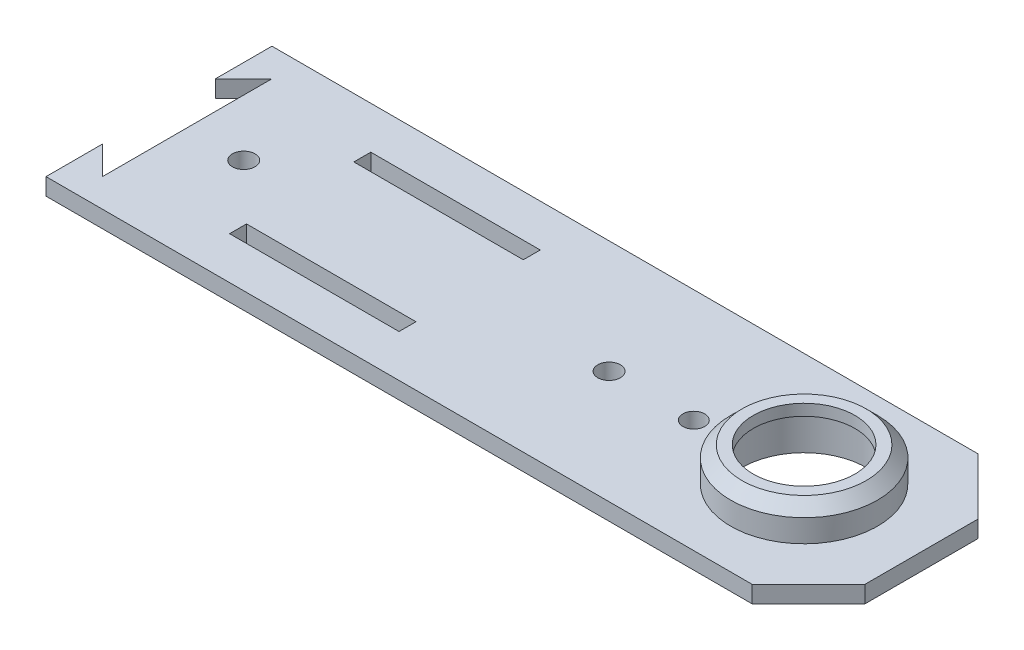
from build123d import *

# Parameters (mm, degrees)
CROQUIS1_R              = 11
CROQUIS1_R_2            = 2
CROQUIS1_R_3            = 1.937672591
CROQUIS1_W              = 30
CROQUIS1_H              = 3
SALIENTE_EXTRUIR1_DEPTH = 3
CROQUIS2_R              = 13
CROQUIS2_R_2            = 11
SALIENTE_EXTRUIR2_DEPTH = 4
CROQUIS3_R              = 13
CROQUIS3_R_2            = 9
SALIENTE_EXTRUIR3_DEPTH = 2
CHAFL_N1_SIZE           = 2
CHAFL_N2_SIZE           = 10


with BuildPart() as part:
    # Croquis1 → Saliente-Extruir1 (new body)
    with BuildSketch(Plane(origin=(0, 0, 0), x_dir=(1, 0, 0), z_dir=(0, 1, 0))):
        Polygon((-67.5, 10), (-62.5, 15), (-62.5, -15), (-67.5, -10), (-67.5, -20), (67.5, -20), (67.5, 20), (-67.5, 20), align=None)
        with Locations((46.713951104, 0)):
            Circle(CROQUIS1_R, mode=Mode.SUBTRACT)
        with Locations((-52.5, 0)):
            Circle(CROQUIS1_R_2, mode=Mode.SUBTRACT)
        with Locations((27.185770037, 0)):
            Circle(CROQUIS1_R_3, mode=Mode.SUBTRACT)
        with Locations((12.185770037, 0)):
            Circle(CROQUIS1_R_2, mode=Mode.SUBTRACT)
        with Locations((-27.5, 11)):
            Rectangle(CROQUIS1_W, CROQUIS1_H, mode=Mode.SUBTRACT)
        with Locations((-27.5, -11)):
            Rectangle(CROQUIS1_W, CROQUIS1_H, mode=Mode.SUBTRACT)
    extrude(amount=SALIENTE_EXTRUIR1_DEPTH)

    # Croquis2 → Saliente-Extruir2 (add)
    with BuildSketch(Plane(origin=(0, 3, 0), x_dir=(1, 0, 0), z_dir=(0, 1, 0))):
        with Locations((46.713951104, 0)):
            Circle(CROQUIS2_R)
        with Locations((46.713951104, 0)):
            Circle(CROQUIS2_R_2, mode=Mode.SUBTRACT)
    extrude(amount=SALIENTE_EXTRUIR2_DEPTH)

    # Croquis3 → Saliente-Extruir3 (add)
    with BuildSketch(Plane(origin=(0, 7, 0), x_dir=(1, 0, 0), z_dir=(0, 1, 0))):
        with Locations((46.713951104, 0)):
            Circle(CROQUIS3_R)
        with Locations((46.713951104, 0)):
            Circle(CROQUIS3_R_2, mode=Mode.SUBTRACT)
    extrude(amount=SALIENTE_EXTRUIR3_DEPTH)

    # Chaflán1
    chafl_n1_edges = [part.edges().sort_by_distance(p)[0] for p in [
        (33.713951104, 9, 0),
    ]]
    chamfer(chafl_n1_edges, length=CHAFL_N1_SIZE)

    # Chaflán2
    chafl_n2_edges = [part.edges().sort_by_distance(p)[0] for p in [
        (67.5, 1.5, -20),
        (67.5, 1.5, 20),
    ]]
    chamfer(chafl_n2_edges, length=CHAFL_N2_SIZE)


solid = part.part
